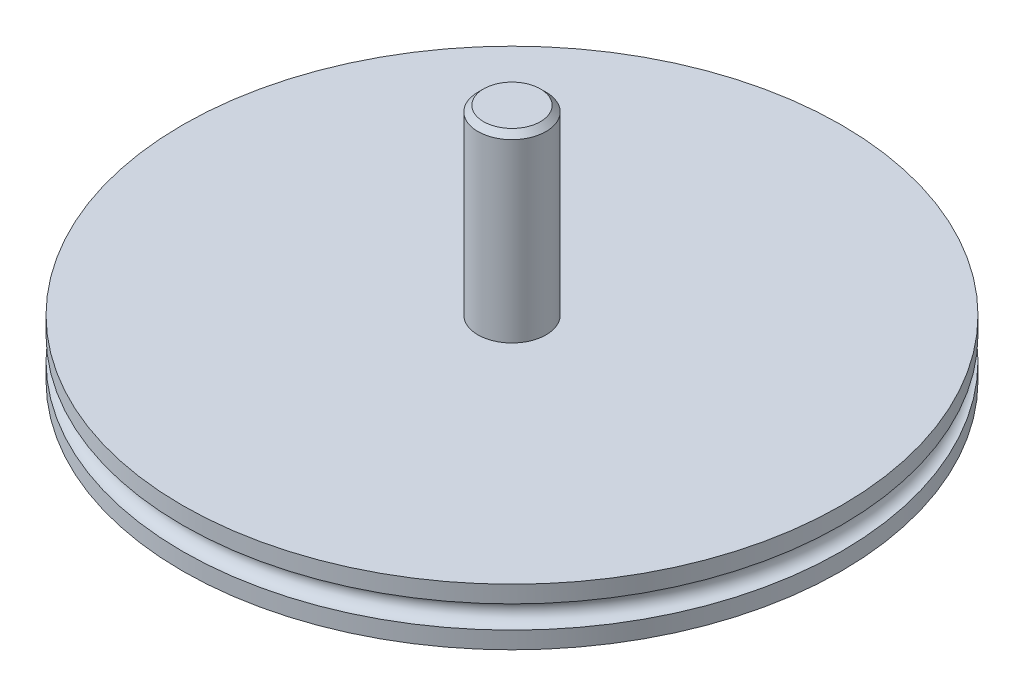
from build123d import *

# Parameters (mm, degrees)
ESQUISSE1_R        = 3
BOSS_EXTRU_1_DEPTH = 16
CHANFREIN1_SIZE    = 0.5


with BuildPart() as part:
    # Esquisse1 → Boss.-Extru.1 (new body)
    with BuildSketch(Plane(origin=(0, 0, 0), x_dir=(1, 0, 0), z_dir=(0, 1, 0))):
        Circle(ESQUISSE1_R)
    extrude(amount=BOSS_EXTRU_1_DEPTH)

    # Esquisse4 → Révolution1 (revolve)
    with BuildSketch(Plane(origin=(0, 0, 0), x_dir=(0, 0, -1), z_dir=(1, 0, 0))):
        with BuildLine():
            Line((0, 0), (29, 0))
            Line((29, 0), (29, -1.5))
            ThreePointArc((29, -1.5), (28, -2.5), (29, -3.5))
            Line((29, -3.5), (29, -5))
            Line((29, -5), (0, -5))
            Line((0, -5), (0, 0))
        make_face()
    revolve(axis=Axis((0, -5, 0), (0, 1, 0)))

    # Chanfrein1
    chanfrein1_edges = [part.edges().sort_by_distance(p)[0] for p in [
        (-3, 16, 0),
    ]]
    chamfer(chanfrein1_edges, length=CHANFREIN1_SIZE)


solid = part.part
